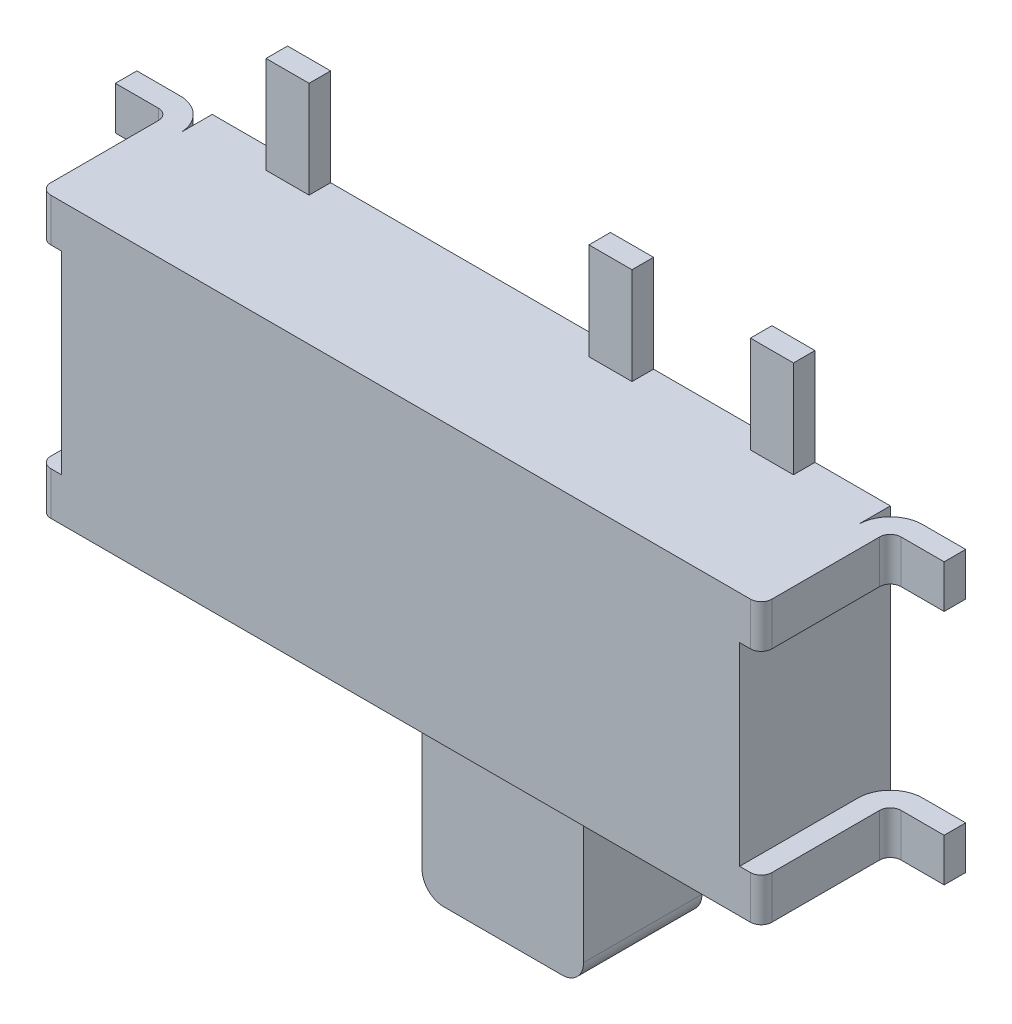
from build123d import *

# Parameters (mm, degrees)
SKETCH2_W            = 6.3
SKETCH2_H            = 2.6
BOSS_EXTRUDE1_DEPTH  = 1.4
EXTRUDE_THIN2_DEPTH  = 0.4
FILLET1_R            = 0.1
FILLET1_OF_MIRROR3_R = 0.1
MIRROR4_DEPTH        = 0.4
MIRROR4_START        = 2.2
MIRROR4_2_DEPTH      = 0.4
SKETCH4_W            = 0.2
SKETCH4_H            = 0.9
EXTRUDE_THIN3_DEPTH  = 0.2
SKETCH5_W            = 0.2
SKETCH5_H            = 0.9
EXTRUDE_THIN4_DEPTH  = 0.2
SKETCH6_W            = 0.2
SKETCH6_H            = 0.9
EXTRUDE_THIN5_DEPTH  = 0.2
SKETCH8_W            = 1.5
SKETCH8_H            = 1.1
BOSS_EXTRUDE2_DEPTH  = 1.5
FILLET2_R            = 0.2


# Read off the part's stored shape, not the designer's step: Mirror4
with BuildPart() as part:
    # Sketch2 → Boss-Extrude1 (new body)
    with BuildSketch(Plane.XY):
        with Locations((3.15, 1.3)):
            Rectangle(SKETCH2_W, SKETCH2_H)
    extrude(amount=BOSS_EXTRUDE1_DEPTH)

    # Sketch3 → Extrude-Thin2 (add)
    with BuildSketch(Plane.XZ):
        with BuildLine():
            Line((0, 1.4), (0, 0.3))
            ThreePointArc((0, 0.3), (-0.087867966, 0.087867966), (-0.3, 0))
            Line((-0.3, 0), (-0.7, 0))
            Line((-0.7, 0), (-0.7, 0.2))
            Line((-0.7, 0.2), (-0.3, 0.2))
            ThreePointArc((-0.3, 0.2), (-0.229289322, 0.229289322), (-0.2, 0.3))
            Line((-0.2, 0.3), (-0.2, 1.4))
            Line((-0.2, 1.4), (0, 1.4))
        make_face()
    extrude_thin2 = extrude(amount=-EXTRUDE_THIN2_DEPTH)

    # Fillet1
    fillet1_edges = [part.edges().sort_by_distance(p)[0] for p in [
        (-0.2, 0.2, 1.4),
    ]]
    fillet(fillet1_edges, radius=FILLET1_R)

    # Mirror3: Extrude-Thin2 across plane
    add(extrude_thin2.mirror(Plane.ZX.offset(1.3)))

    # Fillet1 of Mirror3
    fillet1_of_mirror3_edges = [part.edges().sort_by_distance(p)[0] for p in [
        (-0.2, 2.4, 1.4),
    ]]
    fillet(fillet1_of_mirror3_edges, radius=FILLET1_OF_MIRROR3_R)

    # Mirror4 outline → Mirror4 (add)
    with BuildSketch(Plane(origin=(0, 0, 0), x_dir=(1, 0, 0), z_dir=(0, 1, 0))):
        with BuildLine():
            Line((7, 0), (6.6, 0))
            ThreePointArc((6.6, 0), (6.387867966, -0.087867966), (6.3, -0.3))
            Line((6.3, -0.3), (6.3, -1.4))
            Line((6.3, -1.4), (6.4, -1.4))
            ThreePointArc((6.4, -1.4), (6.470710678, -1.370710678), (6.5, -1.3))
            Line((6.5, -1.3), (6.5, -0.3))
            ThreePointArc((6.5, -0.3), (6.529289322, -0.229289322), (6.6, -0.2))
            Line((6.6, -0.2), (7, -0.2))
            Line((7, -0.2), (7, 0))
        make_face()
    extrude(amount=MIRROR4_DEPTH)

    # Mirror4 2 outline → Mirror4 2 (add)
    with BuildSketch(Plane(origin=(0, 0, 0), x_dir=(1, 0, 0), z_dir=(0, 1, 0)).offset(MIRROR4_START)):
        with BuildLine():
            Line((7, 0), (6.6, 0))
            ThreePointArc((6.6, 0), (6.387867966, -0.087867966), (6.3, -0.3))
            Line((6.3, -0.3), (6.3, -1.4))
            Line((6.3, -1.4), (6.4, -1.4))
            ThreePointArc((6.4, -1.4), (6.470710678, -1.370710678), (6.5, -1.3))
            Line((6.5, -1.3), (6.5, -0.3))
            ThreePointArc((6.5, -0.3), (6.529289322, -0.229289322), (6.6, -0.2))
            Line((6.6, -0.2), (7, -0.2))
            Line((7, -0.2), (7, 0))
        make_face()
    extrude(amount=MIRROR4_2_DEPTH)

    # Sketch4 → Extrude-Thin3 (add, symmetric)
    with BuildSketch(Plane(origin=(0.9, 0, 0), x_dir=(0, 0, -1), z_dir=(1, 0, 0))):
        with Locations((-0.1, 3.05)):
            Rectangle(SKETCH4_W, SKETCH4_H)
    extrude(amount=EXTRUDE_THIN3_DEPTH, both=True)

    # Sketch5 → Extrude-Thin4 (add, symmetric)
    with BuildSketch(Plane(origin=(3.9, 0, 0), x_dir=(0, 0, -1), z_dir=(1, 0, 0))):
        with Locations((-0.1, 3.05)):
            Rectangle(SKETCH5_W, SKETCH5_H)
    extrude(amount=EXTRUDE_THIN4_DEPTH, both=True)

    # Sketch6 → Extrude-Thin5 (add, symmetric)
    with BuildSketch(Plane(origin=(5.4, 0, 0), x_dir=(0, 0, -1), z_dir=(1, 0, 0))):
        with Locations((-0.1, 3.05)):
            Rectangle(SKETCH6_W, SKETCH6_H)
    extrude(amount=EXTRUDE_THIN5_DEPTH, both=True)

    # Sketch8 → Boss-Extrude2 (add)
    with BuildSketch(Plane.XZ):
        with Locations((3.9, 0.65)):
            Rectangle(SKETCH8_W, SKETCH8_H)
    extrude(amount=BOSS_EXTRUDE2_DEPTH)

    # Fillet2
    fillet2_edges = [part.edges().sort_by_distance(p)[0] for p in [
        (3.15, -1.5, 0.65),
        (4.65, -1.5, 0.65),
    ]]
    fillet(fillet2_edges, radius=FILLET2_R)


solid = part.part
